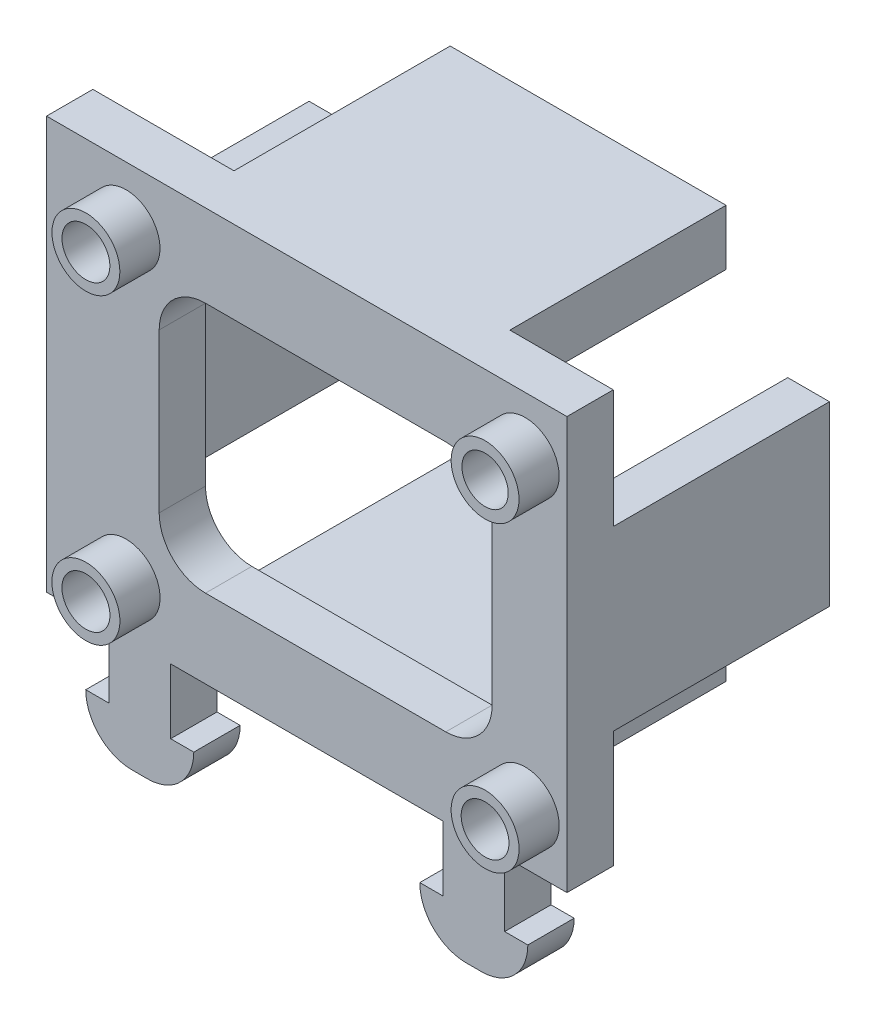
from build123d import *

# Parameters (mm, degrees)
EXTRUDE_1_DEPTH      = 2
EXTRUDE_1_DEPTH_BACK = 1
SKETCH_2_W           = 33.7
SKETCH_2_H           = 26.7
SKETCH_2_R           = 1.500160794
SKETCH_2_R_2         = 1.5
SKETCH_2_R_3         = 1.552324123
SKETCH_2_R_4         = 1.546482565
CUT_EXTRUDE_1_DEPTH  = 3
SKETCH_5_R           = 2.197988189
SKETCH_5_R_2         = 2.198876818
SKETCH_5_R_3         = 2.200287149
SKETCH_5_R_4         = 2.202466949
EXTRUDE_2_DEPTH      = 2.6
CUT_EXTRUDE_START    = -5
SKETCH_6_R           = 1.551176975
SKETCH_6_R_2         = 1.55471391
SKETCH_6_R_3         = 1.548240493
SKETCH_6_R_4         = 1.5
CUT_EXTRUDE_2_DEPTH  = 5
SKETCH_10_W          = 17.866024145
SKETCH_10_H          = 3.498646338
SKETCH_10_H_2        = 3.601530827
SKETCH_10_W_2        = 2.701736104
SKETCH_10_H_3        = 11.479623975
SKETCH_10_W_3        = 5.150482455
EXTRUDE_4_DEPTH      = 14
SKETCH_11_W          = 4.001103287
SKETCH_11_H          = 3.000250535
SKETCH_11_W_2        = 3.995812133
SKETCH_11_H_2        = 3
EXTRUDE_5_DEPTH      = 4.2
SKETCH_12_W          = 6.996994273
SKETCH_12_H          = 3.000250535
SKETCH_12_W_2        = 6.995985491
SKETCH_12_H_2        = 3
EXTRUDE_6_DEPTH      = 3
FILLET_4_R           = 3
FILLET_5_R           = 3
FILLET_6_R           = 3
FILLET_7_R           = 3


with BuildPart() as part:
    # Эскиз2 → Бобышка-Вытянуть1 (new, two sides: drawn at the far end of the back side and taken through both)
    with BuildSketch(Plane.XY.offset(-EXTRUDE_1_DEPTH_BACK)):
        with Locations((16.85, 13.35)):
            Rectangle(SKETCH_2_W, SKETCH_2_H)
        with Locations((30.998263896, 3.498646338)):
            Circle(SKETCH_2_R, mode=Mode.SUBTRACT)
        with Locations((30.998263896, 23.098469173)):
            Circle(SKETCH_2_R_2, mode=Mode.SUBTRACT)
        with Locations((5.150482455, 3.352746683)):
            Circle(SKETCH_2_R_3, mode=Mode.SUBTRACT)
        with Locations((5.150482455, 22.950000581)):
            Circle(SKETCH_2_R_4, mode=Mode.SUBTRACT)
    extrude(amount=EXTRUDE_1_DEPTH + EXTRUDE_1_DEPTH_BACK)

    # Эскиз4 → Вырез-Вытянуть1 (cut)
    with BuildSketch(Plane.XY.offset(2)):
        with BuildLine():
            Line((10.293463676, 5.094435071), (25.855282675, 5.094435071))
            ThreePointArc((25.855282675, 5.094435071), (27.976603018, 5.973114728), (28.855282675, 8.094435071))
            Line((28.855282675, 8.094435071), (28.855282675, 18.354211847))
            ThreePointArc((28.855282675, 18.354211847), (27.976603018, 20.475532191), (25.855282675, 21.354211847))
            Line((25.855282675, 21.354211847), (10.293463676, 21.354211847))
            ThreePointArc((10.293463676, 21.354211847), (8.172143332, 20.475532191), (7.293463676, 18.354211847))
            Line((7.293463676, 18.354211847), (7.293463676, 8.094435071))
            ThreePointArc((7.293463676, 8.094435071), (8.172143332, 5.973114728), (10.293463676, 5.094435071))
        make_face()
    extrude(amount=-CUT_EXTRUDE_1_DEPTH, mode=Mode.SUBTRACT)

    # Эскиз5 → Бобышка-Вытянуть2 (add)
    with BuildSketch(Plane.XY.offset(2)):
        with Locations(Location((5.150482455, 22.950000581, 0), (0, 0, 180))):
            Circle(SKETCH_5_R)
        with Locations(Location((30.998263896, 23.098469173, 0), (0, 0, 180))):
            Circle(SKETCH_5_R_2)
        with Locations(Location((30.998263896, 3.498646338, 0), (0, 0, 180))):
            Circle(SKETCH_5_R_3)
        with Locations(Location((5.150482455, 3.352746683, 0), (0, 0, 180))):
            Circle(SKETCH_5_R_4)
    extrude(amount=EXTRUDE_2_DEPTH)

    # Эскиз6 → Вырез-Вытянуть2 (cut)
    with BuildSketch(Plane.XY.offset(4.6).offset(CUT_EXTRUDE_START)):
        with Locations((5.150482455, 22.950000581)):
            Circle(SKETCH_6_R)
        with Locations((5.150482455, 3.352746683)):
            Circle(SKETCH_6_R_2)
        with Locations((30.998263896, 3.498646338)):
            Circle(SKETCH_6_R_3)
        with Locations((30.998263896, 23.098469173)):
            Circle(SKETCH_6_R_4)
    extrude(amount=CUT_EXTRUDE_2_DEPTH, mode=Mode.SUBTRACT)

    # Эскиз10 → Бобышка-Вытянуть4 (add)
    with BuildSketch(Plane(origin=(0, 0, -1), x_dir=(-1, 0, 0), z_dir=(0, 0, -1))):
        with Locations((-18.071569917, 1.749323169)):
            Rectangle(SKETCH_10_W, SKETCH_10_H)
        with Locations((-18.071569917, 24.899234587)):
            Rectangle(SKETCH_10_W, SKETCH_10_H_2)
        with Locations((-32.349131948, 13.292689749)):
            Rectangle(SKETCH_10_W_2, SKETCH_10_H_3)
        with Locations((-2.575241228, 13.292689749)):
            Rectangle(SKETCH_10_W_3, SKETCH_10_H_3)
    extrude(amount=EXTRUDE_4_DEPTH)

    # Эскиз11 → Бобышка-Вытянуть5 (add)
    with BuildSketch(Plane.XZ):
        with Locations((6.037312514, 0.499874732)):
            Rectangle(SKETCH_11_W, SKETCH_11_H)
        with Locations((27.668636997, 0.5)):
            Rectangle(SKETCH_11_W_2, SKETCH_11_H_2)
    extrude(amount=EXTRUDE_5_DEPTH)

    # Эскиз12 → Бобышка-Вытянуть6 (add)
    with BuildSketch(Plane.XZ.offset(4.2)):
        with Locations((6.037312514, 0.499874732)):
            Rectangle(SKETCH_12_W, SKETCH_12_H)
        with Locations((27.668636997, 0.5)):
            Rectangle(SKETCH_12_W_2, SKETCH_12_H_2)
    extrude(amount=EXTRUDE_6_DEPTH)

    # Скругление4
    fillet_4_edges = [part.edges().sort_by_distance(p)[0] for p in [
        (2.538815377, -7.2, 0.499874732),
    ]]
    fillet(fillet_4_edges, radius=FILLET_4_R - 0.0001)  # a hair under: the kernel refuses the full size

    # Скругление5
    fillet_5_edges = [part.edges().sort_by_distance(p)[0] for p in [
        (9.53580965, -7.2, 0.499874732),
    ]]
    fillet(fillet_5_edges, radius=FILLET_5_R - 0.0001)  # a hair under: the kernel refuses the full size

    # Скругление6
    fillet_6_edges = [part.edges().sort_by_distance(p)[0] for p in [
        (31.166629742, -7.2, 0.5),
    ]]
    fillet(fillet_6_edges, radius=FILLET_6_R - 0.0001)  # a hair under: the kernel refuses the full size

    # Скругление7
    fillet_7_edges = [part.edges().sort_by_distance(p)[0] for p in [
        (24.170644251, -7.2, 0.5),
    ]]
    fillet(fillet_7_edges, radius=FILLET_7_R - 0.0001)  # a hair under: the kernel refuses the full size


solid = part.part
